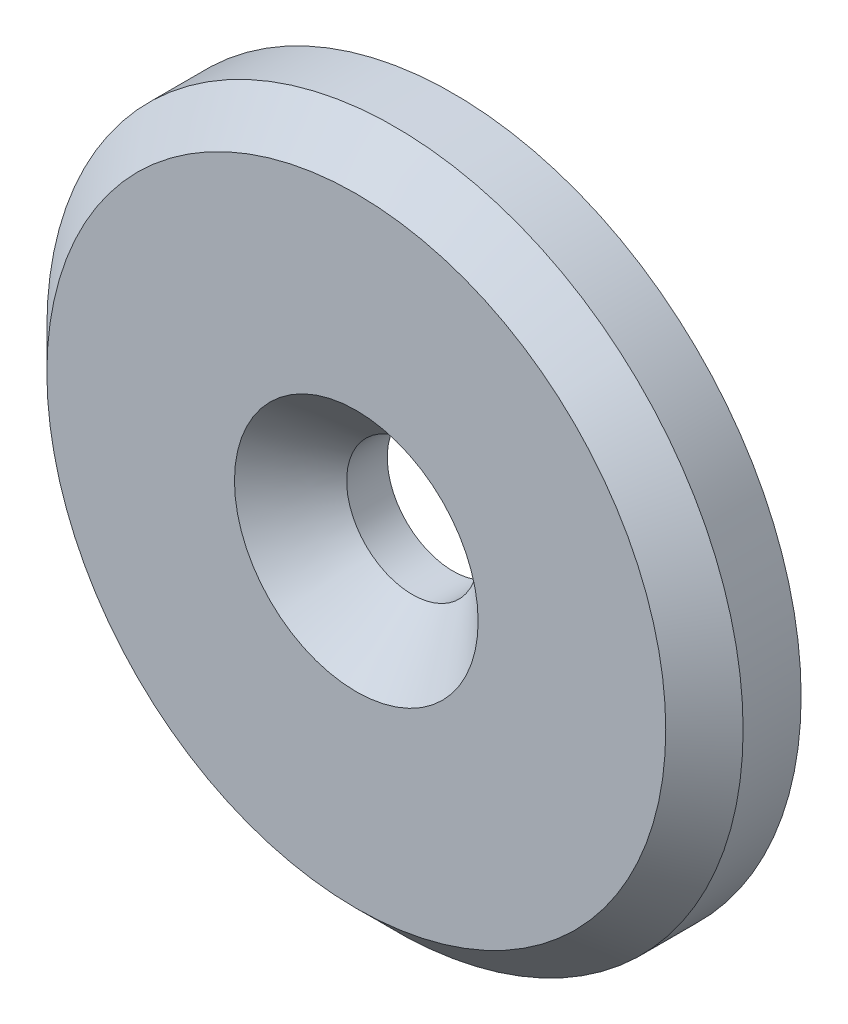
from build123d import *

# Parameters (mm, degrees)
SKETCH_1_R      = 9
EXTRUDE_1_DEPTH = 2.5
CHAMFER_1_SIZE  = 1


with BuildPart() as part:
    # Эскиз1 → Бобышка-Вытянуть1 (new body)
    with BuildSketch(Plane.XY):
        Circle(SKETCH_1_R)
    extrude(amount=EXTRUDE_1_DEPTH)

    # Фаска1
    chamfer_1_edges = [part.edges().sort_by_distance(p)[0] for p in [
        (-9, 0, 2.5),
    ]]
    chamfer(chamfer_1_edges, length=CHAMFER_1_SIZE)

    # Эскиз4 → Зенковка для винта с полупотайной головкой M31 (revolve, cut)
    with BuildSketch(Plane(origin=(0, 0, 2.5), x_dir=(0, -1, 0), z_dir=(1, 0, 0))):
        Polygon((0, 0), (0, 2.5), (1.7, 2.5), (1.7, 1.45), (3.15, 0), align=None)
    revolve(axis=Axis((0, 0, 8.85), (0, 0, -1)), mode=Mode.SUBTRACT)


solid = part.part
